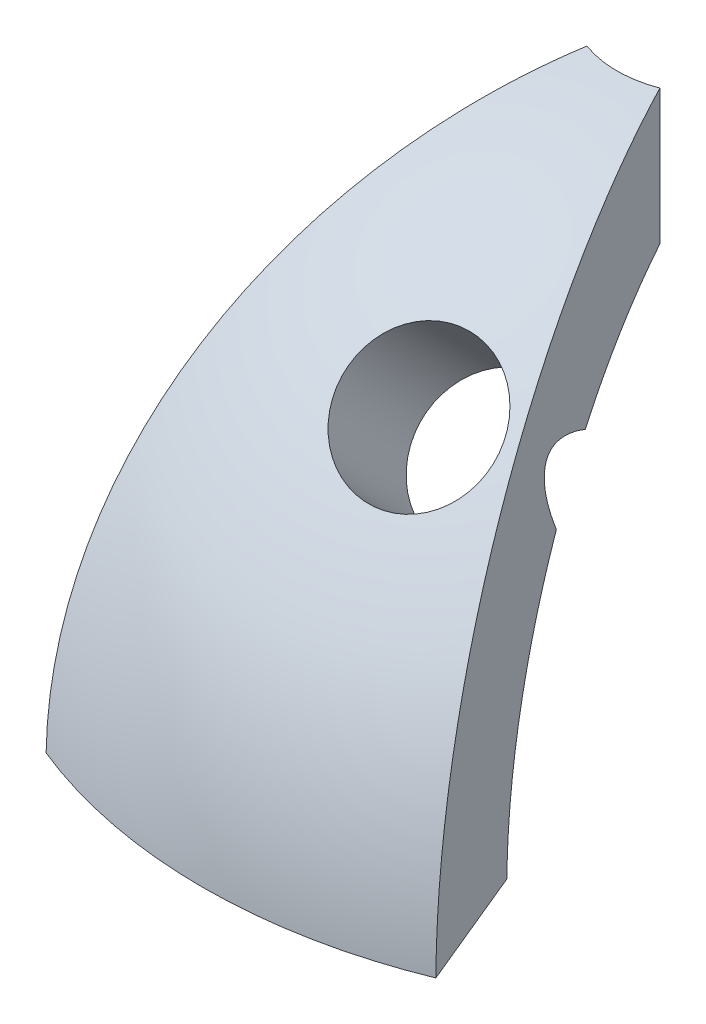
from build123d import *

# Parameters (mm, degrees)
REVOLVE1_ANGLE            = 45
CUT_EXTRUDE1_DEPTH        = 28.647117169
CUT_EXTRUDE1_DEPTH_BACK   = 28.647117169
CUT_EXTRUDE4_REACH        = 29.998
CUT_EXTRUDE4_START_RADIUS = 14.22
CUT_EXTRUDE4_END_RADIUS   = 14.22
CUT_EXTRUDE5_DEPTH        = 26.992100662
CUT_EXTRUDE5_DEPTH_BACK   = 26.992100662
SKETCH9_R                 = 2.6035


with BuildPart() as part:
    # Sketch1 → Revolve1 (revolve, symmetric)
    with BuildSketch(Plane(origin=(0, 0, 0), x_dir=(0, 0, -1), z_dir=(1, 0, 0))) as revolve1_sk:
        with BuildLine():
            Line((-14.217802221, 0.25), (-19.048359509, 0.25))
            ThreePointArc((-19.048359509, 0.25), (-14.676690222, 12.144845166), (-3.81, 18.66511184))
            Line((-3.81, 18.66511184), (-3.81, 13.700083941))
            ThreePointArc((-3.81, 13.700083941), (-11.246181696, 8.70240181), (-14.217802221, 0.25))
        make_face()
    revolve(axis=Axis((0, 0, 0), (0, 1, 0)), revolution_arc=REVOLVE1_ANGLE / 2)
    revolve(revolve1_sk.sketch, axis=Axis((0, 0, 0), (0, -1, 0)), revolution_arc=REVOLVE1_ANGLE / 2)

    # Sketch2 → Cut-Extrude1 (cut, two sides: drawn at the far end of the back side and taken through both)
    with BuildSketch(Plane(origin=(0, 0, 0), x_dir=(1, 0, 0), z_dir=(0, 1, 0)).offset(-CUT_EXTRUDE1_DEPTH_BACK)):
        with BuildLine():
            Line((7.289491598, -17.598389479), (1.458023877, -3.519981019))
            ThreePointArc((1.458023877, -3.519981019), (1.400077392, -3.543428184), (1.341754023, -3.5659215))
            Line((1.341754023, -3.5659215), (7.173849701, -17.645845983))
            ThreePointArc((7.173849701, -17.645845983), (7.231709577, -17.622212591), (7.289491598, -17.598389479))
        make_face()
        with BuildLine():
            Line((-7.173849701, -17.645845983), (-1.341754023, -3.5659215))
            ThreePointArc((-1.341754023, -3.5659215), (-1.400077392, -3.543428184), (-1.458023877, -3.519981019))
            Line((-1.458023877, -3.519981019), (-7.289491598, -17.598389479))
            ThreePointArc((-7.289491598, -17.598389479), (-7.231709577, -17.622212591), (-7.173849701, -17.645845983))
        make_face()
    extrude(amount=CUT_EXTRUDE1_DEPTH + CUT_EXTRUDE1_DEPTH_BACK, mode=Mode.SUBTRACT)

    # Cut-Extrude4: from a sphere face, 29.998 long prism both ways, kept between that surface and its translate by the depth
    cut_extrude4_start = Location((0, 0, 0)) * Sphere(CUT_EXTRUDE4_START_RADIUS, mode=Mode.PRIVATE)
    cut_extrude4_end = Location((0, 0.145802388, 0.351998102)) * Sphere(CUT_EXTRUDE4_END_RADIUS, mode=Mode.PRIVATE)
    # Sketch8 → Cut-Extrude4 (cut, from a surface)
    with BuildSketch(Plane(origin=(0, 0, 0), x_dir=(-1, 0, 0), z_dir=(0, 0.3826834323650899, 0.9238795325112868)), mode=Mode.PRIVATE) as cut_extrude4_sk1:
        Polygon((0.887753405, -0.619026887), (0.968782051, -0.619026887), (0.968782051, 2.458280805), (1.481666667, 2.458280805), (1.481666667, 2.914178241), (0.968782051, 2.914178241), (0.968782051, 3.939947472), (0.569871795, 3.939947472), (0.569871795, 2.914178241), (-1.538653846, 2.914178241), align=None)
        Polygon((0.569871795, 2.458280805), (0.569871795, 0.5278401), (-0.755080128, 2.458280805), align=None, mode=Mode.SUBTRACT)
    cut_extrude4_tool1 = extrude(cut_extrude4_sk1.sketch, amount=CUT_EXTRUDE4_REACH, both=True, mode=Mode.PRIVATE)
    add(((cut_extrude4_tool1 - cut_extrude4_start) & cut_extrude4_end).solids().sort_by_distance((0, 7.838946, 9.725445))[0], mode=Mode.SUBTRACT)

    # Sketch9 → Cut-Extrude5 (cut, two sides: drawn at the far end of the back side and taken through both)
    with BuildSketch(Plane(origin=(2.950125281, 18.858537854, 18.626357959), x_dir=(-0.8917235779063104, -0.23968096505674769, 0.3839037582460406), z_dir=(-0.1106158710412275, -0.7071067811865475, -0.6984011233337121)).offset(-CUT_EXTRUDE5_DEPTH_BACK)):
        Circle(SKETCH9_R)
    extrude(amount=CUT_EXTRUDE5_DEPTH + CUT_EXTRUDE5_DEPTH_BACK, mode=Mode.SUBTRACT)


solid = part.part
